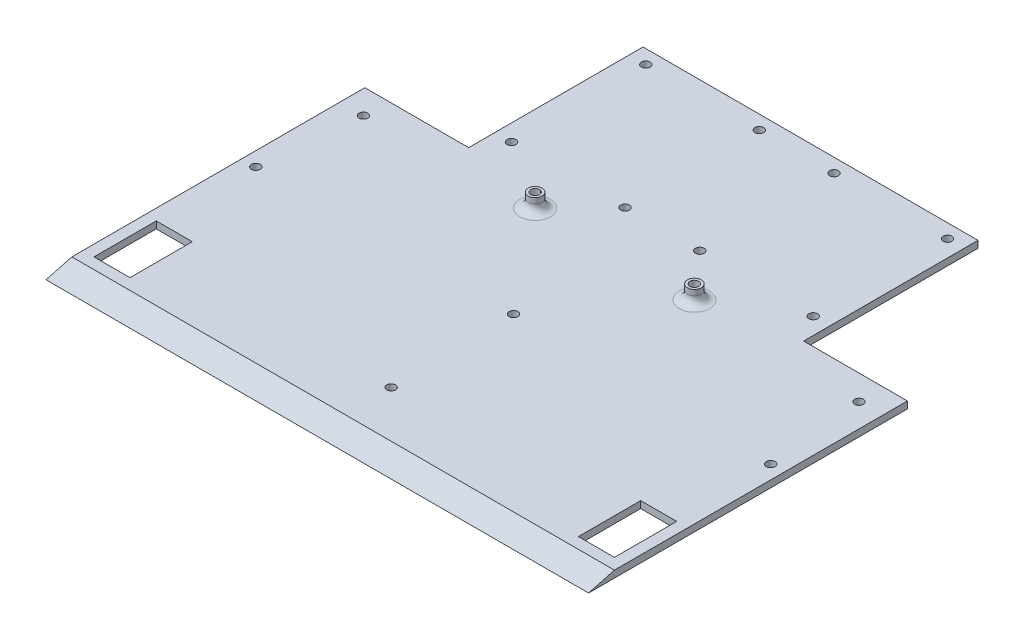
from build123d import *

# Parameters (mm, degrees)
SALIENTE_EXTRUIR1_DEPTH = 196
CORTAR_EXTRUIR1_REACH   = 266.89
CROQUIS2_W              = 37.5
CROQUIS2_H              = 62.989872981
CORTAR_EXTRUIR2_REACH   = 266.89
CROQUIS4_W              = 13
CROQUIS4_H              = 22.5
CUT_EXTRUDE1_REACH      = 266.89
SKETCH1_R               = 1.585
CUT_EXTRUDE2_REACH      = 266.89
SKETCH2_R               = 1.585
CUT_EXTRUDE3_REACH      = 266.89
SKETCH3_R               = 1.585
SKETCH4_R               = 2.5
SKETCH4_R_2             = 1.6
BOSS_EXTRUDE1_DEPTH     = 5
SKETCH7_R               = 1.585
CUT_EXTRUDE5_DEPTH      = 10
SKETCH8_R               = 1.6
CUT_EXTRUDE6_DEPTH      = 265.925553505
FILLET1_R               = 3


with BuildPart() as part:
    # Croquis1 → Saliente-Extruir1 (new body)
    with BuildSketch(Plane(origin=(0, 0, 0), x_dir=(0, 0, -1), z_dir=(1, 0, 0))):
        Polygon((0, 0), (178.17, 0), (178.17, 2.5), (9.330127019, 2.5), align=None)
    extrude(amount=SALIENTE_EXTRUIR1_DEPTH)

    # Croquis2 → Cortar-Extruir1 (cut, up to next)
    with BuildSketch(Plane(origin=(0, 0, 0), x_dir=(-1, 0, 0), z_dir=(0, -1, 0)), mode=Mode.PRIVATE) as cortar_extruir1_sk1:
        with Locations((-18.75, 146.67506351)):
            Rectangle(CROQUIS2_W, CROQUIS2_H)
    cortar_extruir1_tool1 = extrude(cortar_extruir1_sk1.sketch, amount=-CORTAR_EXTRUIR1_REACH, mode=Mode.PRIVATE) & part.part
    # Croquis2 → Cortar-Extruir1 (cut, up to next)
    with BuildSketch(Plane(origin=(0, 0, 0), x_dir=(-1, 0, 0), z_dir=(0, -1, 0)), mode=Mode.PRIVATE) as cortar_extruir1_sk2:
        with Locations((-177.25, 146.67506351)):
            Rectangle(CROQUIS2_W, CROQUIS2_H)
    cortar_extruir1_tool2 = extrude(cortar_extruir1_sk2.sketch, amount=-CORTAR_EXTRUIR1_REACH, mode=Mode.PRIVATE) & part.part
    add(cortar_extruir1_tool1.solids().sort_by_distance((18.75, 0, -146.675064))[0], mode=Mode.SUBTRACT)
    add(cortar_extruir1_tool2.solids().sort_by_distance((177.25, 0, -146.675064))[0], mode=Mode.SUBTRACT)

    # Croquis4 → Cortar-Extruir2 (cut, up to next)
    with BuildSketch(Plane(origin=(0, 2.5, 0), x_dir=(1, 0, 0), z_dir=(0, 1, 0)), mode=Mode.PRIVATE) as cortar_extruir2_sk1:
        with Locations((10.5, 24.580127019)):
            Rectangle(CROQUIS4_W, CROQUIS4_H)
    cortar_extruir2_tool1 = extrude(cortar_extruir2_sk1.sketch, amount=-CORTAR_EXTRUIR2_REACH, mode=Mode.PRIVATE) & part.part
    cortar_extruir2 = cortar_extruir2_tool1.solids().sort_by_distance((10.5, 2.5, -24.580127))[0]
    add(cortar_extruir2, mode=Mode.SUBTRACT)

    # Simetría1: Cortar-Extruir2 across plane
    add(cortar_extruir2.mirror(Plane(origin=(98, 0, 0), x_dir=(0, 0, 1), z_dir=(1, 0, 0))), mode=Mode.SUBTRACT)

    # Sketch1 → Cut-Extrude1 (cut, up to next)
    with BuildSketch(Plane(origin=(0, 2.5, 0), x_dir=(1, 0, 0), z_dir=(0, 1, 0)), mode=Mode.PRIVATE) as cut_extrude1_sk1:
        with Locations((187.5, 106.180127019)):
            Circle(SKETCH1_R)
    cut_extrude1_tool1 = extrude(cut_extrude1_sk1.sketch, amount=-CUT_EXTRUDE1_REACH, mode=Mode.PRIVATE) & part.part
    # Sketch1 → Cut-Extrude1 (cut, up to next)
    with BuildSketch(Plane(origin=(0, 2.5, 0), x_dir=(1, 0, 0), z_dir=(0, 1, 0)), mode=Mode.PRIVATE) as cut_extrude1_sk2:
        with Locations((8.5, 106.180127019)):
            Circle(SKETCH1_R)
    cut_extrude1_tool2 = extrude(cut_extrude1_sk2.sketch, amount=-CUT_EXTRUDE1_REACH, mode=Mode.PRIVATE) & part.part
    add(cut_extrude1_tool1.solids().sort_by_distance((187.5, 2.5, -106.180127))[0], mode=Mode.SUBTRACT)
    add(cut_extrude1_tool2.solids().sort_by_distance((8.5, 2.5, -106.180127))[0], mode=Mode.SUBTRACT)

    # Sketch2 → Cut-Extrude2 (cut, up to next)
    with BuildSketch(Plane(origin=(0, 2.5, 0), x_dir=(1, 0, 0), z_dir=(0, 1, 0)), mode=Mode.PRIVATE) as cut_extrude2_sk1:
        with Locations((98.5, 26.180127019)):
            Circle(SKETCH2_R)
    cut_extrude2_tool1 = extrude(cut_extrude2_sk1.sketch, amount=-CUT_EXTRUDE2_REACH, mode=Mode.PRIVATE) & part.part
    add(cut_extrude2_tool1.solids().sort_by_distance((98.5, 2.5, -26.180127))[0], mode=Mode.SUBTRACT)

    # Sketch3 → Cut-Extrude3 (cut, up to next)
    with BuildSketch(Plane(origin=(0, 2.5, 0), x_dir=(1, 0, 0), z_dir=(0, 1, 0)), mode=Mode.PRIVATE) as cut_extrude3_sk1:
        with Locations((111.5, 124.67)):
            Circle(SKETCH3_R)
    cut_extrude3_tool1 = extrude(cut_extrude3_sk1.sketch, amount=-CUT_EXTRUDE3_REACH, mode=Mode.PRIVATE) & part.part
    # Sketch3 → Cut-Extrude3 (cut, up to next)
    with BuildSketch(Plane(origin=(0, 2.5, 0), x_dir=(1, 0, 0), z_dir=(0, 1, 0)), mode=Mode.PRIVATE) as cut_extrude3_sk2:
        with Locations((152.5, 124.67)):
            Circle(SKETCH3_R)
    cut_extrude3_tool2 = extrude(cut_extrude3_sk2.sketch, amount=-CUT_EXTRUDE3_REACH, mode=Mode.PRIVATE) & part.part
    # Sketch3 → Cut-Extrude3 (cut, up to next)
    with BuildSketch(Plane(origin=(0, 2.5, 0), x_dir=(1, 0, 0), z_dir=(0, 1, 0)), mode=Mode.PRIVATE) as cut_extrude3_sk3:
        with Locations((152.5, 173.17)):
            Circle(SKETCH3_R)
    cut_extrude3_tool3 = extrude(cut_extrude3_sk3.sketch, amount=-CUT_EXTRUDE3_REACH, mode=Mode.PRIVATE) & part.part
    # Sketch3 → Cut-Extrude3 (cut, up to next)
    with BuildSketch(Plane(origin=(0, 2.5, 0), x_dir=(1, 0, 0), z_dir=(0, 1, 0)), mode=Mode.PRIVATE) as cut_extrude3_sk4:
        with Locations((111.5, 173.17)):
            Circle(SKETCH3_R)
    cut_extrude3_tool4 = extrude(cut_extrude3_sk4.sketch, amount=-CUT_EXTRUDE3_REACH, mode=Mode.PRIVATE) & part.part
    # Sketch3 → Cut-Extrude3 (cut, up to next)
    with BuildSketch(Plane(origin=(0, 2.5, 0), x_dir=(1, 0, 0), z_dir=(0, 1, 0)), mode=Mode.PRIVATE) as cut_extrude3_sk5:
        with Locations((84.5, 173.17)):
            Circle(SKETCH3_R)
    cut_extrude3_tool5 = extrude(cut_extrude3_sk5.sketch, amount=-CUT_EXTRUDE3_REACH, mode=Mode.PRIVATE) & part.part
    # Sketch3 → Cut-Extrude3 (cut, up to next)
    with BuildSketch(Plane(origin=(0, 2.5, 0), x_dir=(1, 0, 0), z_dir=(0, 1, 0)), mode=Mode.PRIVATE) as cut_extrude3_sk6:
        with Locations((43.5, 173.17)):
            Circle(SKETCH3_R)
    cut_extrude3_tool6 = extrude(cut_extrude3_sk6.sketch, amount=-CUT_EXTRUDE3_REACH, mode=Mode.PRIVATE) & part.part
    # Sketch3 → Cut-Extrude3 (cut, up to next)
    with BuildSketch(Plane(origin=(0, 2.5, 0), x_dir=(1, 0, 0), z_dir=(0, 1, 0)), mode=Mode.PRIVATE) as cut_extrude3_sk7:
        with Locations((43.5, 124.67)):
            Circle(SKETCH3_R)
    cut_extrude3_tool7 = extrude(cut_extrude3_sk7.sketch, amount=-CUT_EXTRUDE3_REACH, mode=Mode.PRIVATE) & part.part
    # Sketch3 → Cut-Extrude3 (cut, up to next)
    with BuildSketch(Plane(origin=(0, 2.5, 0), x_dir=(1, 0, 0), z_dir=(0, 1, 0)), mode=Mode.PRIVATE) as cut_extrude3_sk8:
        with Locations((84.5, 124.67)):
            Circle(SKETCH3_R)
    cut_extrude3_tool8 = extrude(cut_extrude3_sk8.sketch, amount=-CUT_EXTRUDE3_REACH, mode=Mode.PRIVATE) & part.part
    add(cut_extrude3_tool1.solids().sort_by_distance((111.5, 2.5, -124.67))[0], mode=Mode.SUBTRACT)
    add(cut_extrude3_tool2.solids().sort_by_distance((152.5, 2.5, -124.67))[0], mode=Mode.SUBTRACT)
    add(cut_extrude3_tool3.solids().sort_by_distance((152.5, 2.5, -173.17))[0], mode=Mode.SUBTRACT)
    add(cut_extrude3_tool4.solids().sort_by_distance((111.5, 2.5, -173.17))[0], mode=Mode.SUBTRACT)
    add(cut_extrude3_tool5.solids().sort_by_distance((84.5, 2.5, -173.17))[0], mode=Mode.SUBTRACT)
    add(cut_extrude3_tool6.solids().sort_by_distance((43.5, 2.5, -173.17))[0], mode=Mode.SUBTRACT)
    add(cut_extrude3_tool7.solids().sort_by_distance((43.5, 2.5, -124.67))[0], mode=Mode.SUBTRACT)
    add(cut_extrude3_tool8.solids().sort_by_distance((84.5, 2.5, -124.67))[0], mode=Mode.SUBTRACT)

    # Sketch4 → Boss-Extrude1 (add)
    # profile 1 of 2: a face of its own
    with BuildSketch(Plane(origin=(0, 2.5, 0), x_dir=(1, 0, 0), z_dir=(0, 1, 0))):
        with Locations((68.415265875, 108.280438226)):
            Circle(SKETCH4_R)
        with Locations((68.415265875, 108.280438226)):
            Circle(SKETCH4_R_2, mode=Mode.SUBTRACT)
    # profile 2 of 2: a face of its own
    with BuildSketch(Plane(origin=(0, 2.5, 0), x_dir=(1, 0, 0), z_dir=(0, 1, 0))):
        with Locations((125.876416732, 108.336862559)):
            Circle(SKETCH4_R)
        with Locations((125.876416732, 108.336862559)):
            Circle(SKETCH4_R_2, mode=Mode.SUBTRACT)
    extrude(amount=BOSS_EXTRUDE1_DEPTH)

    # Sketch7 → Cut-Extrude5 (cut)
    with BuildSketch(Plane(origin=(0, 2.5, 0), x_dir=(1, 0, 0), z_dir=(0, 1, 0))):
        with Locations((5.067111952, 70.727811806)):
            Circle(SKETCH7_R)
        with Locations((97.681935477, 71.208529763)):
            Circle(SKETCH7_R)
        with Locations((191.067111952, 70.727811806)):
            Circle(SKETCH7_R)
    extrude(amount=-CUT_EXTRUDE5_DEPTH, mode=Mode.SUBTRACT)

    # Sketch8 → Cut-Extrude6 (cut, through all)
    with BuildSketch(Plane(origin=(0, 2.5, 0), x_dir=(1, 0, 0), z_dir=(0, 1, 0))):
        with Locations((68.415265875, 108.280438226)):
            Circle(SKETCH8_R)
        with Locations((125.876416732, 108.336862559)):
            Circle(SKETCH8_R)
    extrude(amount=-CUT_EXTRUDE6_DEPTH, mode=Mode.SUBTRACT)

    # Fillet1
    fillet1_edges = [part.edges().sort_by_distance(p)[0] for p in [
        (65.915265875, 2.5, -108.280438226),
        (123.376416732, 2.5, -108.336862559),
    ]]
    fillet(fillet1_edges, radius=FILLET1_R)


solid = part.part
